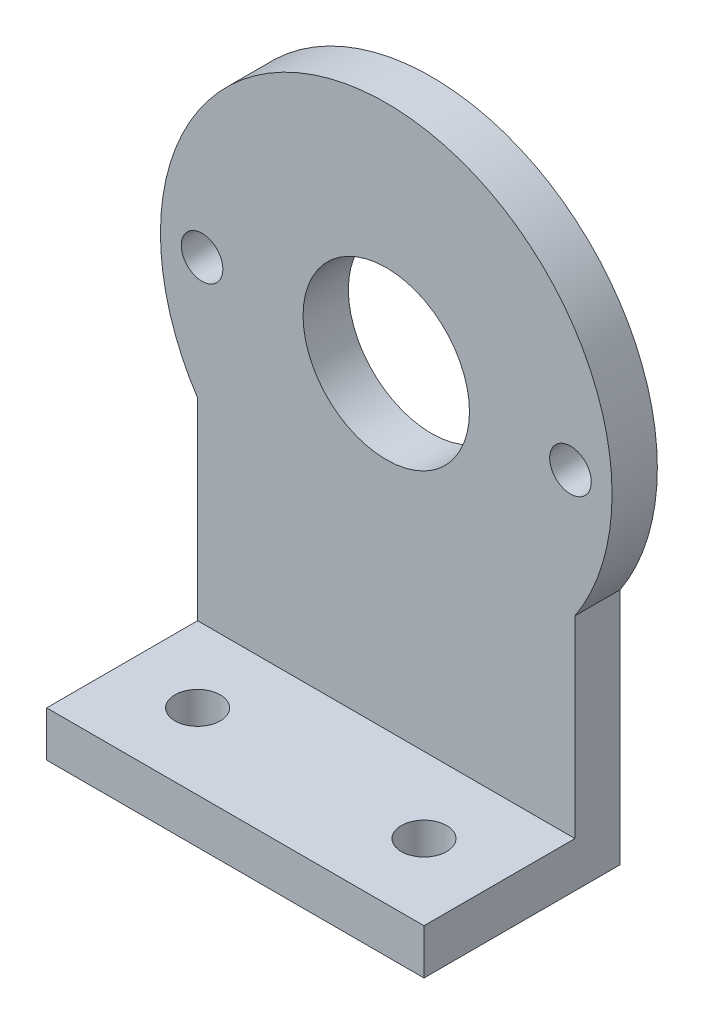
from build123d import *

# Parameters (mm, degrees)
SKETCH1_R           = 19
SKETCH1_W           = 31.75
SKETCH1_H           = 20.04044182
BOSS_EXTRUDE1_DEPTH = 3.81
SKETCH3_R           = 7
CUT_EXTRUDE1_DEPTH  = 37.118506337
SKETCH4_W           = 31.75
SKETCH4_H           = 3.81
BOSS_EXTRUDE2_DEPTH = 12.7
SKETCH5_R           = 1.905
CUT_EXTRUDE2_DEPTH  = 53.147185926
SKETCH6_R           = 1.75
CUT_EXTRUDE3_DEPTH  = 39.096199285


with BuildPart() as part:
    # Sketch1 → Boss-Extrude1 (new body)
    with BuildSketch(Plane.XY):
        Circle(SKETCH1_R)
        with Locations((0, -20.45977909)):
            Rectangle(SKETCH1_W, SKETCH1_H)
    extrude(amount=BOSS_EXTRUDE1_DEPTH)

    # Sketch3 → Cut-Extrude1 (cut, through all)
    with BuildSketch(Plane.XY.offset(3.81)):
        Circle(SKETCH3_R)
    extrude(amount=-CUT_EXTRUDE1_DEPTH, mode=Mode.SUBTRACT)

    # Sketch4 → Boss-Extrude2 (add)
    with BuildSketch(Plane.XY.offset(3.81)):
        with Locations((0, -28.575)):
            Rectangle(SKETCH4_W, SKETCH4_H)
    extrude(amount=BOSS_EXTRUDE2_DEPTH)

    # Sketch5 → Cut-Extrude2 (cut, through all)
    with BuildSketch(Plane(origin=(0, -26.67, 0), x_dir=(1, 0, 0), z_dir=(0, 1, 0))):
        with Locations((-9.525, -10.16)):
            Circle(SKETCH5_R)
        with Locations((9.525, -10.16)):
            Circle(SKETCH5_R)
    extrude(amount=-CUT_EXTRUDE2_DEPTH, mode=Mode.SUBTRACT)

    # Sketch6 → Cut-Extrude3 (cut, through all)
    with BuildSketch(Plane.XY.offset(3.81)):
        with Locations((15.5, 0)):
            Circle(SKETCH6_R)
        with Locations((-15.5, 0)):
            Circle(SKETCH6_R)
    extrude(amount=-CUT_EXTRUDE3_DEPTH, mode=Mode.SUBTRACT)


solid = part.part
